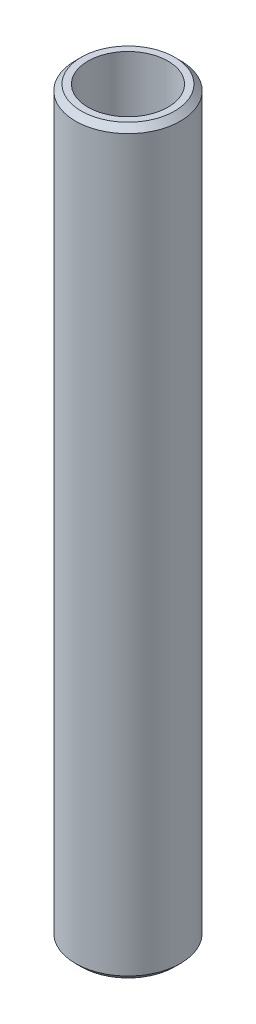
from build123d import *

# Parameters (mm, degrees)
SKETCH1_R           = 42.5
BOSS_EXTRUDE1_DEPTH = 600
SKETCH2_R           = 32.387985262
CUT_EXTRUDE1_DEPTH  = 604.002902149
CHAMFER1_SIZE       = 4.699297682


with BuildPart() as part:
    # Sketch1 → Boss-Extrude1 (new body)
    with BuildSketch(Plane(origin=(0, 0, 0), x_dir=(1, 0, 0), z_dir=(0, 1, 0))):
        Circle(SKETCH1_R)
    extrude(amount=BOSS_EXTRUDE1_DEPTH)

    # Sketch2 → Cut-Extrude1 (cut, through all)
    with BuildSketch(Plane(origin=(0, 0, 0), x_dir=(1, 0, 0), z_dir=(0, 1, 0))):
        Circle(SKETCH2_R)
    extrude(amount=CUT_EXTRUDE1_DEPTH, mode=Mode.SUBTRACT)

    # Chamfer1
    chamfer1_edges = [part.edges().sort_by_distance(p)[0] for p in [
        (-42.5, 600, 0),
        (-42.5, 0, 0),
    ]]
    chamfer(chamfer1_edges, length=CHAMFER1_SIZE)


solid = part.part
